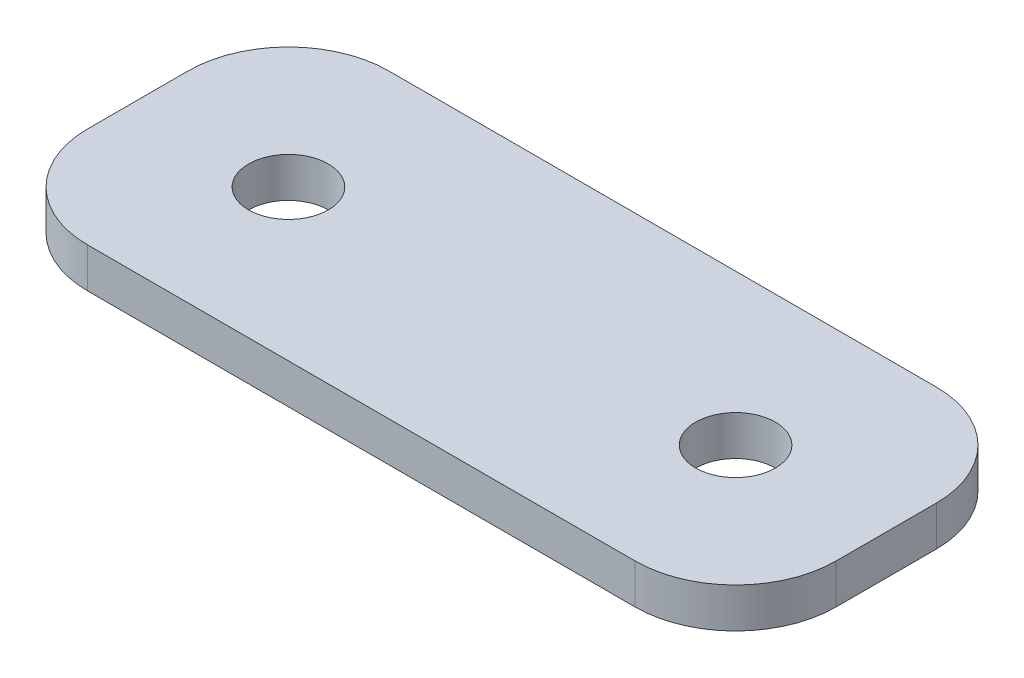
from build123d import *

# Parameters (mm, degrees)
SKETCH1_W           = 29.81
SKETCH1_H           = 12
SKETCH1_R           = 1.5875
BOSS_EXTRUDE1_DEPTH = 0.79375
FILLET1_R           = 4


with BuildPart() as part:
    # Sketch1 → Boss-Extrude1 (new, symmetric)
    with BuildSketch(Plane(origin=(0, 0, 0), x_dir=(1, 0, 0), z_dir=(0, 1, 0))):
        Rectangle(SKETCH1_W, SKETCH1_H)
        with Locations((-8.905, 0)):
            Circle(SKETCH1_R, mode=Mode.SUBTRACT)
        with Locations((8.905, 0)):
            Circle(SKETCH1_R, mode=Mode.SUBTRACT)
    extrude(amount=BOSS_EXTRUDE1_DEPTH, both=True)

    # Fillet1
    fillet1_edges = [part.edges().sort_by_distance(p)[0] for p in [
        (-14.905, 0, -6),
        (-14.905, 0, 6),
        (14.905, 0, 6),
        (14.905, 0, -6),
    ]]
    fillet(fillet1_edges, radius=FILLET1_R)


solid = part.part
